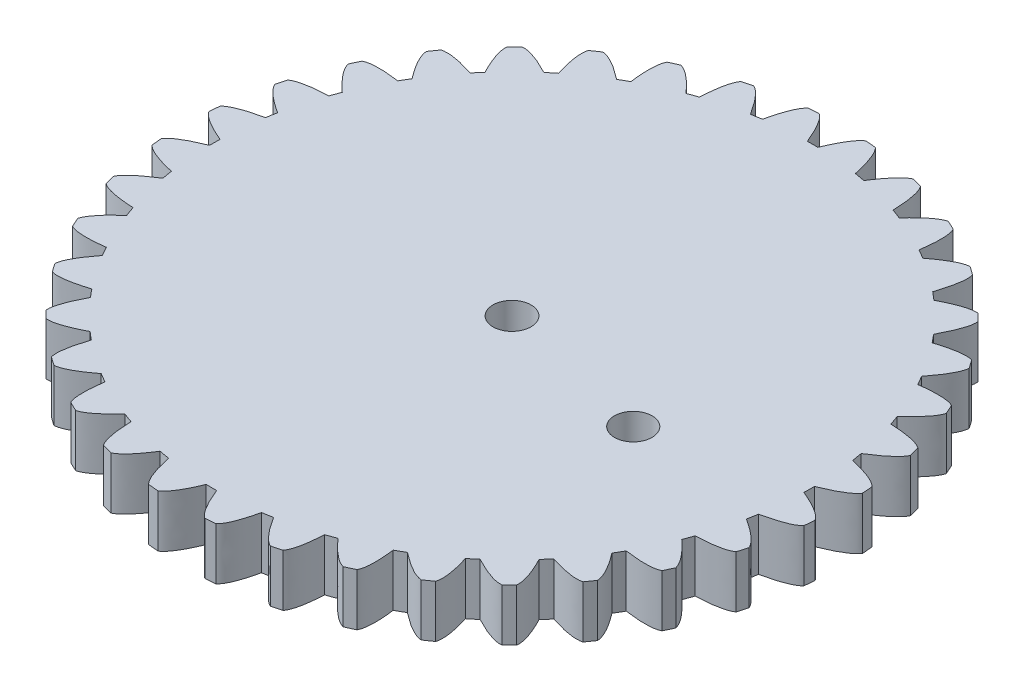
from build123d import *

# Parameters (mm, degrees)
BOSS_EXTRUDE4_DEPTH = 5
CIRPATTERN6_COUNT   = 36
SKETCH2_R           = 1.825
CUT_EXTRUDE2_DEPTH  = 10
SKETCH4_R           = 1.8
CUT_EXTRUDE3_DEPTH  = 10


with BuildPart() as part:
    # Sketch1 → Boss-Extrude4 (new body)
    with BuildSketch(Plane(origin=(0, 0, 0), x_dir=(1, 0, 0), z_dir=(0, 1, 0))):
        with BuildLine():
            ThreePointArc((22.805736751, 21.8420485), (22.457036123, 22.200410807), (22.102704987, 22.553206948))
            add(Edge.make_bspline(
                [(22.102704987, 22.553206948), (21.149593054, 22.664461932), (18.918639135, 21.512477328)],
                knots=[0.625101597, 0.625101597, 0.625101597, 1, 1, 1], degree=2))
            ThreePointArc((18.918639135, 21.512477328), (-20.37318884, -20.140376461), (21.728482418, 18.670153703))
            add(Edge.make_bspline(
                [(21.728482418, 18.670153703), (22.906030578, 20.887720895), (22.805736751, 21.8420485)],
                knots=[0, 0, 0, 0.374898403, 0.374898403, 0.374898403], degree=2))
        make_face()
    boss_extrude4 = extrude(amount=BOSS_EXTRUDE4_DEPTH)

    # CirPattern6: Boss-Extrude4 ×36 about axis
    cirpattern6_axis = Axis((0, 5, 0), (0, 1, 0))
    for i in range(1, CIRPATTERN6_COUNT):
        add(boss_extrude4.rotate(cirpattern6_axis, i * 360 / CIRPATTERN6_COUNT))

    # Sketch2 → Cut-Extrude2 (cut)
    with BuildSketch(Plane(origin=(0, 5, 0), x_dir=(1, 0, 0), z_dir=(0, 1, 0))):
        Circle(SKETCH2_R)
    extrude(amount=-CUT_EXTRUDE2_DEPTH, mode=Mode.SUBTRACT)

    # Sketch4 → Cut-Extrude3 (cut)
    with BuildSketch(Plane.XZ):
        with Locations((15, 3.380352036)):
            Circle(SKETCH4_R)
    extrude(amount=-CUT_EXTRUDE3_DEPTH, mode=Mode.SUBTRACT)


solid = part.part
